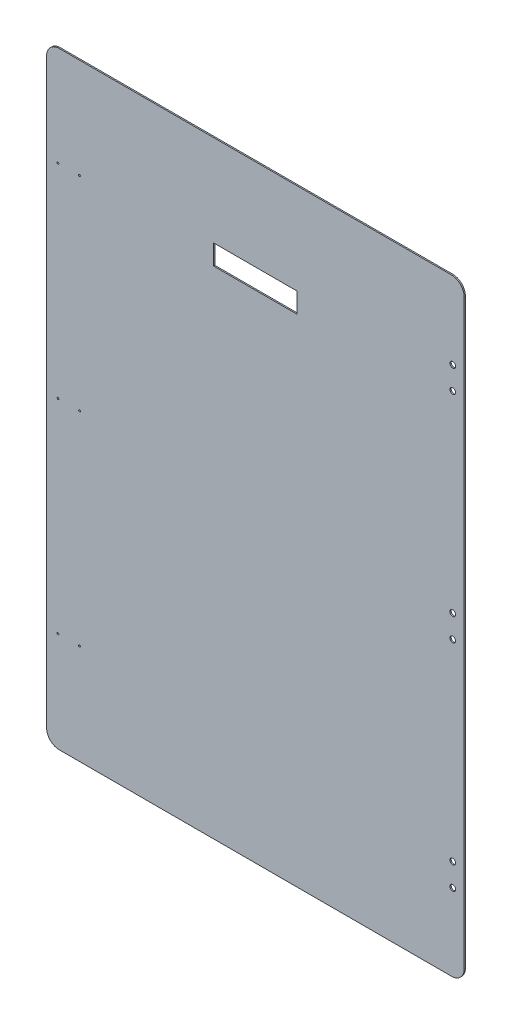
from build123d import *

# Parameters (mm, degrees)
BASE_FLANGE1_DEPTH     = 2
M8_CLEARANCE_HOLE1_D   = 9
SKETCH8_W              = 132
SKETCH8_H              = 31.7
CUT_EXTRUDE1_DEPTH     = 10
M2_5_CLEARANCE_HOLE2_D = 2.9


# Sheet-metal steps are written as plain solids
with BuildPart() as part:
    # Sketch1 → Base-Flange1 (new body)
    with BuildSketch(Plane.XY):
        with BuildLine():
            Line((310, -480), (-310, -480))
            ThreePointArc((-310, -480), (-324.142135624, -474.142135624), (-330, -460))
            Line((-330, -460), (-330, 460))
            ThreePointArc((-330, 460), (-324.142135624, 474.142135624), (-310, 480))
            Line((-310, 480), (310, 480))
            ThreePointArc((310, 480), (324.142135624, 474.142135624), (330, 460))
            Line((330, 460), (330, -460))
            ThreePointArc((330, -460), (324.142135624, -474.142135624), (310, -480))
        make_face()
    extrude(amount=-BASE_FLANGE1_DEPTH)

    # M8 Clearance Hole1 (through all)
    with Locations(Plane.XY):
        with Locations((312, 358), (312, 322), (312, 18), (312, -18), (312, -322), (312, -358)):
            Hole(M8_CLEARANCE_HOLE1_D / 2)

    # Sketch8 → Cut-Extrude1 (cut)
    with BuildSketch(Plane.XY):
        with Locations((0, 320)):
            Rectangle(SKETCH8_W, SKETCH8_H)
    extrude(amount=-CUT_EXTRUDE1_DEPTH, mode=Mode.SUBTRACT)

    # M2.5 Clearance Hole2 (through all)
    with Locations(Plane.XY):
        with Locations((-277.999999662, -322), (-311.999999662, 322), (-277.999999662, 322), (-311.999999662, 0), (-277.999999662, 0), (-311.999999662, -322)):
            Hole(M2_5_CLEARANCE_HOLE2_D / 2)


solid = part.part
